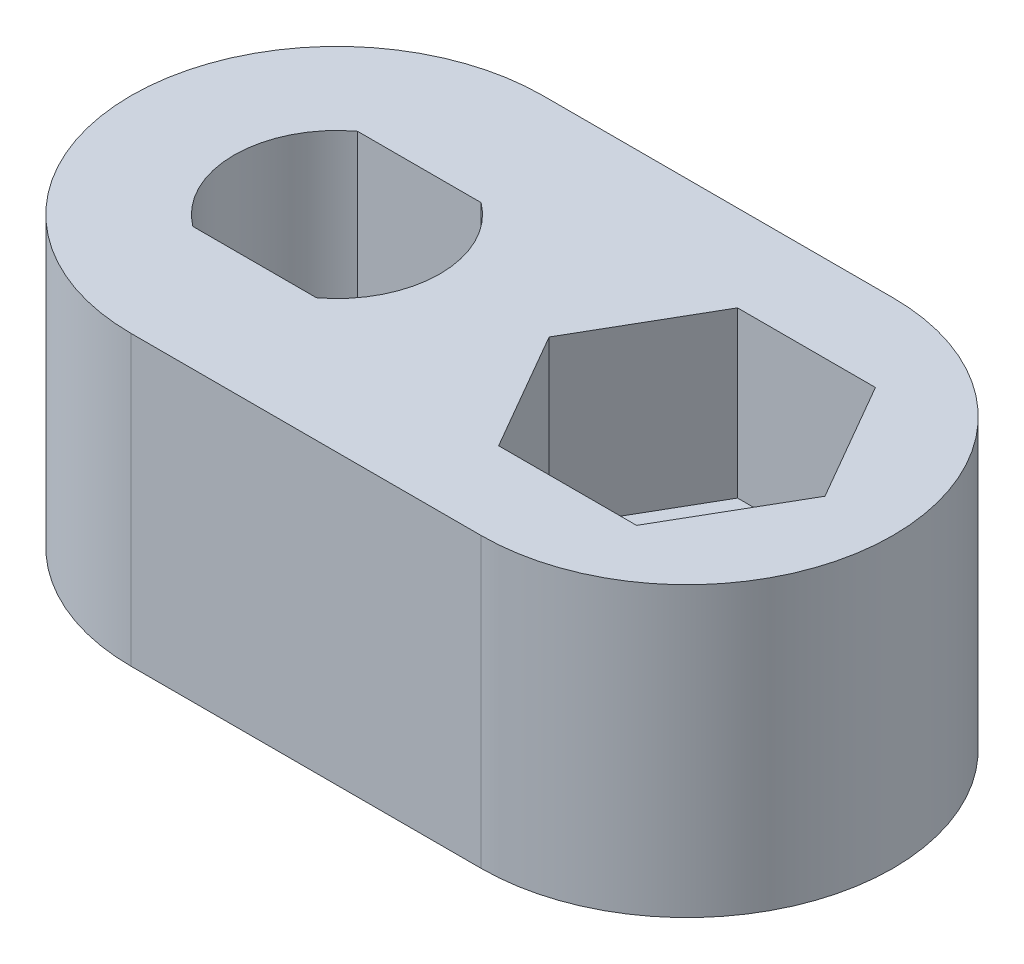
from build123d import *

# Parameters (mm, degrees)
BOSS_EXTRUDE1_DEPTH                                  = 7
CUT_EXTRUDE1_DEPTH                                   = 4
CSK_FOR_M3_HEX_SOCKET_COUNTERSUNK_CAP_SC_D           = 3.4
CSK_FOR_M3_HEX_SOCKET_COUNTERSUNK_CAP_SC_DEPTH       = 7.5
CSK_FOR_M3_HEX_SOCKET_COUNTERSUNK_CAP_SC_CSINK_D     = 6.72
CSK_FOR_M3_HEX_SOCKET_COUNTERSUNK_CAP_SC_CSINK_ANGLE = 90
CSK_FOR_M3_HEX_SOCKET_COUNTERSUNK_CAP_SC_TIP         = 1.021463052
HOLE1_D                                              = 4.15
CUT_EXTRUDE2_DEPTH                                   = 4


with BuildPart() as part:
    # Sketch1 → Boss-Extrude1 (new body)
    with BuildSketch(Plane(origin=(0, 0, 0), x_dir=(1, 0, 0), z_dir=(0, 1, 0))):
        with BuildLine():
            Line((0, 5), (8.5, 5))
            ThreePointArc((8.5, 5), (13.5, 0), (8.5, -5))
            Line((8.5, -5), (0, -5))
            ThreePointArc((0, -5), (-5, 0), (0, 5))
        make_face()
    extrude(amount=BOSS_EXTRUDE1_DEPTH)

    # Sketch2 → Cut-Extrude1 (cut)
    with BuildSketch(Plane(origin=(0, 7, 0), x_dir=(1, 0, 0), z_dir=(0, 1, 0))):
        with BuildLine():
            ThreePointArc((-1.5, 2), (-2.5, 0), (-1.5, -2))
            Line((-1.5, -2), (1.5, -2))
            ThreePointArc((1.5, -2), (2.236067977, -1.118033989), (2.5, 0))
            ThreePointArc((2.5, 0), (2.236067977, 1.118033989), (1.5, 2))
            Line((1.5, 2), (-1.5, 2))
        make_face()
    extrude(amount=-CUT_EXTRUDE1_DEPTH, mode=Mode.SUBTRACT)

    # CSK for M3 Hex Socket Countersunk Cap Screw2
    with Locations(Plane(origin=(0, 0, 0), x_dir=(-1, 0, 0), z_dir=(0, -1, 0))):
        with Locations((0, 0)):
            CounterSinkHole(CSK_FOR_M3_HEX_SOCKET_COUNTERSUNK_CAP_SC_D / 2, CSK_FOR_M3_HEX_SOCKET_COUNTERSUNK_CAP_SC_CSINK_D / 2, depth=CSK_FOR_M3_HEX_SOCKET_COUNTERSUNK_CAP_SC_DEPTH, counter_sink_angle=CSK_FOR_M3_HEX_SOCKET_COUNTERSUNK_CAP_SC_CSINK_ANGLE)
            with Locations((0, 0, -(CSK_FOR_M3_HEX_SOCKET_COUNTERSUNK_CAP_SC_DEPTH + CSK_FOR_M3_HEX_SOCKET_COUNTERSUNK_CAP_SC_TIP / 2))):  # 118° drill point
                Cone(0, CSK_FOR_M3_HEX_SOCKET_COUNTERSUNK_CAP_SC_D / 2, CSK_FOR_M3_HEX_SOCKET_COUNTERSUNK_CAP_SC_TIP, mode=Mode.SUBTRACT)

    # Hole1 (through all)
    with Locations(Plane(origin=(0, 0, 0), x_dir=(-1, 0, 0), z_dir=(0, -1, 0))):
        with Locations((-8.5, 0)):
            Hole(HOLE1_D / 2)

    # Sketch11 → Cut-Extrude2 (cut)
    with BuildSketch(Plane(origin=(0, 7, 0), x_dir=(1, 0, 0), z_dir=(0, 1, 0))):
        Polygon((11.848631561, 0), (10.174315781, 2.9), (6.825684219, 2.9), (5.151368439, 0), (6.825684219, -2.9), (10.174315781, -2.9), align=None)
    extrude(amount=-CUT_EXTRUDE2_DEPTH, mode=Mode.SUBTRACT)


solid = part.part
